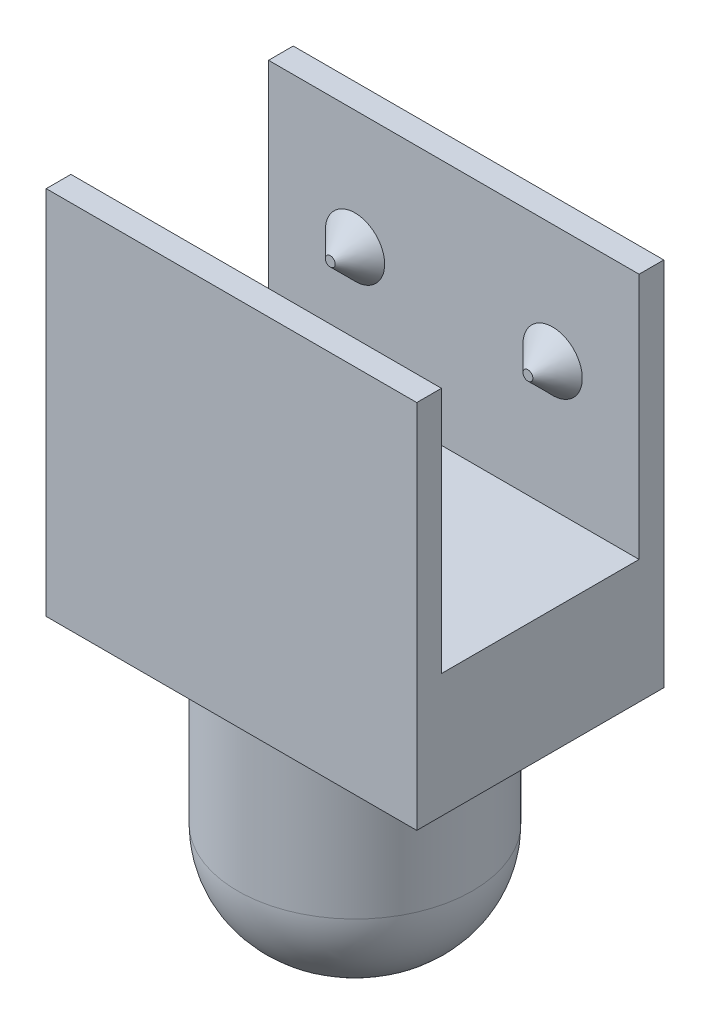
from build123d import *

# Parameters (mm, degrees)
SKETCH1_W                = 19.05
SKETCH1_H                = 19.05
BOSS_EXTRUDE1_DEPTH      = 6.35
SKETCH2_W                = 19.05
SKETCH2_H                = 12.7
CUT_EXTRUDE1_DEPTH       = 5.08
SKETCH3_R                = 1.524
BOSS_EXTRUDE2_DEPTH      = 1.27
CHAMFER1_SIZE            = 1.27
CHAMFER1_OF_MIRROR1_SIZE = 1.27
SKETCH4_R                = 6.0325
BOSS_EXTRUDE3_DEPTH      = 12.7
FILLET1_R                = 5.08


with BuildPart() as part:
    # Sketch1 → Boss-Extrude1 (new, symmetric)
    with BuildSketch(Plane.XY):
        with Locations((9.525, -9.525)):
            Rectangle(SKETCH1_W, SKETCH1_H)
    extrude(amount=BOSS_EXTRUDE1_DEPTH, both=True)

    # Sketch2 → Cut-Extrude1 (cut, symmetric)
    with BuildSketch(Plane.XY):
        with Locations((9.525, -6.35)):
            Rectangle(SKETCH2_W, SKETCH2_H)
    extrude(amount=CUT_EXTRUDE1_DEPTH, both=True, mode=Mode.SUBTRACT)

    # Sketch3 → Boss-Extrude2 (add)
    with BuildSketch(Plane.XY.offset(-5.08)):
        with Locations((14.605, -6.096)):
            Circle(SKETCH3_R)
        with Locations((4.445, -6.096)):
            Circle(SKETCH3_R)
    boss_extrude2 = extrude(amount=BOSS_EXTRUDE2_DEPTH)

    # Chamfer1
    chamfer1_edges = [part.edges().sort_by_distance(p)[0] for p in [
        (13.081, -6.096, -3.81),
        (2.921, -6.096, -3.81),
    ]]
    chamfer(chamfer1_edges, length=CHAMFER1_SIZE - 0.0001)  # a hair under: the kernel refuses the full size

    # Mirror1: Boss-Extrude2 across plane
    add(boss_extrude2.mirror(Plane.XY))

    # Chamfer1 of Mirror1
    chamfer1_of_mirror1_edges = [part.edges().sort_by_distance(p)[0] for p in [
        (13.081, -6.096, 3.81),
        (2.921, -6.096, 3.81),
    ]]
    chamfer(chamfer1_of_mirror1_edges, length=CHAMFER1_OF_MIRROR1_SIZE - 0.0001)  # a hair under: the kernel refuses the full size

    # Sketch4 → Boss-Extrude3 (add)
    with BuildSketch(Plane.XZ.offset(19.05)):
        with Locations((9.525, 0)):
            Circle(SKETCH4_R)
    extrude(amount=BOSS_EXTRUDE3_DEPTH)

    # Fillet1
    fillet1_edges = [part.edges().sort_by_distance(p)[0] for p in [
        (3.4925, -31.75, 0),
    ]]
    fillet(fillet1_edges, radius=FILLET1_R)


solid = part.part
